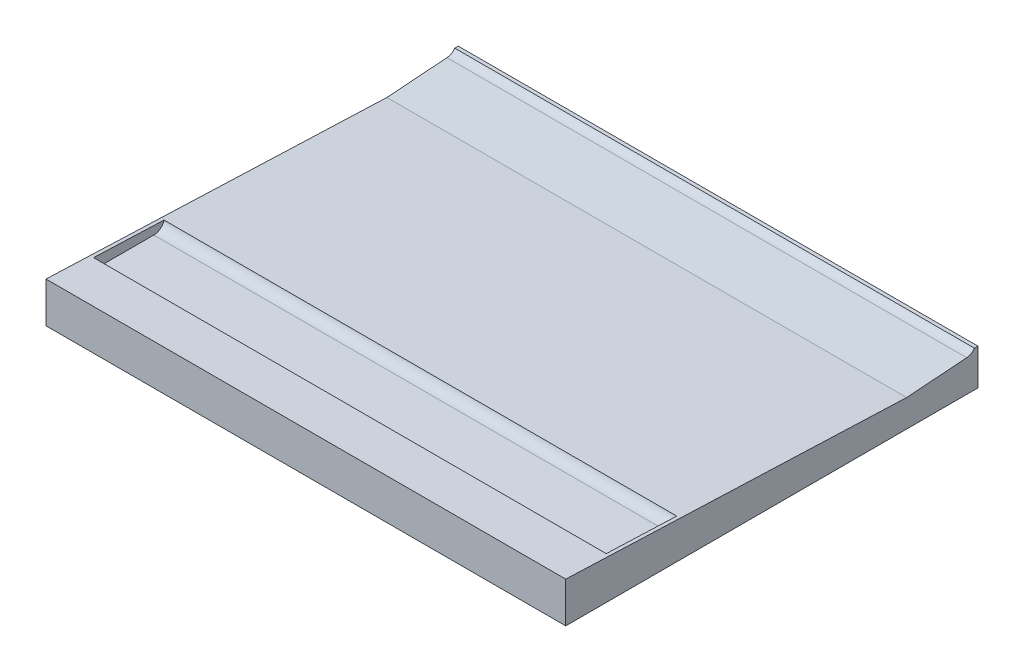
from build123d import *

# Parameters (mm, degrees)
SKETCH1_W           = 295
SKETCH1_H           = 234
BOSS_EXTRUDE1_DEPTH = 28
CUT_EXTRUDE1_DEPTH  = 300
CHAMFER1_SIZE       = 5
CHAMFER2_SIZE       = 5
SKETCH3_W           = 40
SKETCH3_H           = 12.256911823
CUT_EXTRUDE2_DEPTH  = 300
BOSS_EXTRUDE2_DEPTH = 2
BOSS_EXTRUDE3_DEPTH = 295
FILLET1_R           = 6
FILLET2_R           = 6
CHAMFER3_SIZE       = 5


with BuildPart() as part:
    # Sketch1 → Boss-Extrude1 (new body)
    with BuildSketch(Plane(origin=(0, 0, 0), x_dir=(1, 0, 0), z_dir=(0, 1, 0))):
        Rectangle(SKETCH1_W, SKETCH1_H)
    extrude(amount=BOSS_EXTRUDE1_DEPTH)

    # Sketch2 → Cut-Extrude1 (cut)
    with BuildSketch(Plane.ZY.offset(147.5)):
        Polygon((117, 28), (-76.5, 20.5), (-117, 23.5), (-117, 28), align=None)
    extrude(amount=-CUT_EXTRUDE1_DEPTH, mode=Mode.SUBTRACT)

    # Chamfer1
    chamfer1_edges = [part.edges().sort_by_distance(p)[0] for p in [
        (147.5, 0, 0),
        (-147.5, 0, 0),
    ]]
    chamfer(chamfer1_edges, length=CHAMFER1_SIZE)

    # Chamfer2
    chamfer2_edges = [part.edges().sort_by_distance(p)[0] for p in [
        (0, 0, 117),
    ]]
    chamfer(chamfer2_edges, length=CHAMFER2_SIZE)

    # Sketch3 → Cut-Extrude2 (cut)
    with BuildSketch(Plane.ZY.offset(147.5)):
        with Locations((72, 27.159463664)):
            Rectangle(SKETCH3_W, SKETCH3_H)
    extrude(amount=-CUT_EXTRUDE2_DEPTH, mode=Mode.SUBTRACT)

    # Sketch4 → Boss-Extrude2 (add)
    with BuildSketch(Plane.ZY.offset(147.5)):
        Polygon((92, 27.031007752), (52, 25.480620155), (52, 21.031007752), (92, 21.031007752), align=None)
    boss_extrude2 = extrude(amount=-BOSS_EXTRUDE2_DEPTH)

    # Mirror1: Boss-Extrude2 across plane
    add(boss_extrude2.mirror(Plane(origin=(0, 0, 0), x_dir=(0, 0, 1), z_dir=(1, 0, 0))))

    # Sketch5 → Boss-Extrude3 (add)
    with BuildSketch(Plane.ZY.offset(147.5)):
        Polygon((-117, 23.5), (-115, 23.351851852), (-115, 25.5), (-117, 25.5), align=None)
    extrude(amount=-BOSS_EXTRUDE3_DEPTH)

    # Fillet1
    # the kernel refuses this fillet: 6 mm, written as the material it adds along each edge
    with BuildSketch(Plane(origin=(-147.5, 23.351851852, -115), x_dir=(0, -0.0738716855153118, 0.997267754456709), z_dir=(1, 0, 0))) as fillet1_piece_1:
        with BuildLine():
            CenterArc((4.436743859, -6), FILLET1_R, 90, 49.987589721)
            Line((-0.158687324, -2.14227888), (-0.250595948, -2.065124458))
            ThreePointArc((-0.250595948, -2.065124458), (-0.199015793, -1.062274838), (-0.119672131, 0.008864602))
            Line((-0.119672131, 0.008864602), (0, 0.12))
            Line((0, 0.12), (4.436743859, 0.12))
            Line((4.436743859, 0.12), (4.436743859, 0))
        make_face()
    extrude(amount=295)

    # Fillet2
    # the kernel refuses this fillet: 6 mm, written as the material it adds along each edge
    with BuildSketch(Plane(origin=(-145.5, 21.031007752, 92), x_dir=(0, 1, 0), z_dir=(1, 0, 0))) as fillet2_piece_1:
        with BuildLine():
            CenterArc((FILLET2_R, -FILLET2_R), FILLET2_R, 90, 90)
            Line((0, -FILLET2_R), (-FILLET2_R * 0.02, -FILLET2_R))
            Line((-FILLET2_R * 0.02, -FILLET2_R), (-FILLET2_R * 0.02, FILLET2_R * 0.02))
            Line((-FILLET2_R * 0.02, FILLET2_R * 0.02), (FILLET2_R, FILLET2_R * 0.02))
            Line((FILLET2_R, FILLET2_R * 0.02), (FILLET2_R, 0))
        make_face()
    extrude(amount=291)
    with BuildSketch(Plane(origin=(-145.5, 21.031007752, 52), x_dir=(0, 1, 0), z_dir=(1, 0, 0))) as fillet2_piece_2:
        with BuildLine():
            CenterArc((6, 5.796231388), FILLET2_R, 180, 75.024977641)
            Line((0, 5.796231388), (-0.12, 5.796231388))
            Line((-0.12, 5.796231388), (-0.12, 0))
            Line((-0.12, 0), (0, -0.12))
            ThreePointArc((0, -0.12), (2.224806202, -0.12), (4.418604651, -0.115924628))
            Line((4.418604651, -0.115924628), (4.449612403, 0))
        make_face()
    extrude(amount=291)

    # Chamfer3
    chamfer3_edges = [part.edges().sort_by_distance(p)[0] for p in [
        (0, 0, -117),
    ]]
    chamfer(chamfer3_edges, length=CHAMFER3_SIZE)


solid = part.part
